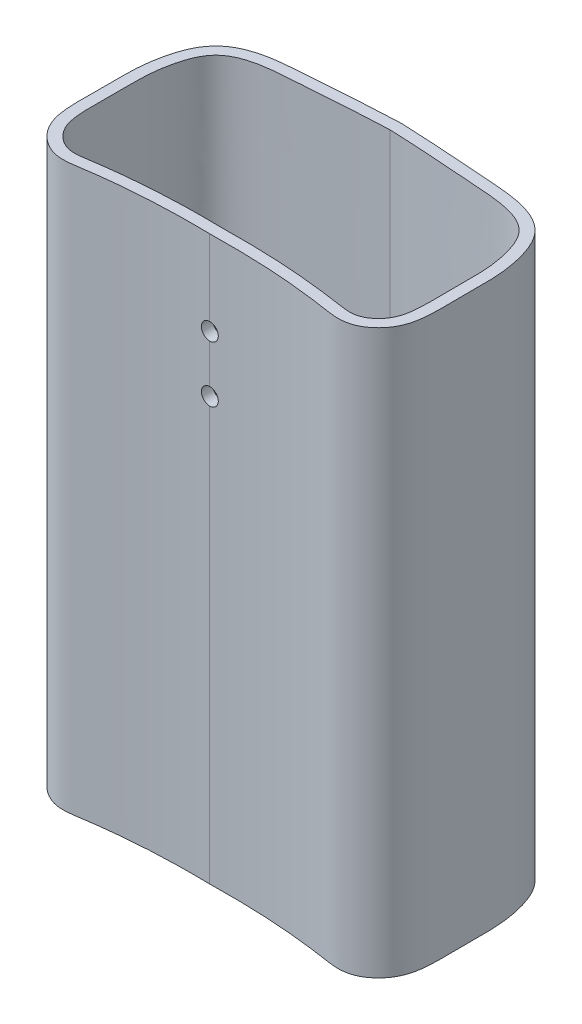
from build123d import *

# Parameters (mm, degrees)
Y_KSEKLIK_EKSTR_ZYON1_DEPTH = 100
IZIM3_R                     = 1.5
KES_EKSTR_ZYON1_DEPTH       = 10


with BuildPart() as part:
    # Çizim1 → Yükseklik-Ekstrüzyon1 (new body)
    with BuildSketch(Plane(origin=(0, 0, 0), x_dir=(1, 0, 0), z_dir=(0, 1, 0))):
        with BuildLine():
            add(Edge.make_bspline(
                [(0, 19.93026058), (-0.456912568, 19.913044156), (-1.378839943, 19.876102375), (-3.156788416, 19.794351658), (-5.316920069, 19.678016457), (-7.841775812, 19.519464651), (-11.189989105, 19.289535487), (-14.591856328, 19.030001897), (-18.287199098, 18.784185441), (-21.261903526, 18.486143303), (-24.224686789, 17.856341815), (-26.580303347, 16.823221448), (-28.255147115, 15.518782085), (-29.688879781, 13.830583224), (-30.777655499, 11.429600247), (-31.51434839, 8.588281022), (-31.923221921, 5.825022746), (-32.0440681, 3.056583967), (-31.987890956, 0.428578042), (-32.01708483, -2.068301489), (-32.051981724, -4.710614271), (-32.003565709, -7.406147252), (-31.648596651, -10.011539852), (-30.627497359, -12.156132439), (-29.506723331, -13.557042968), (-28.106496306, -14.69864579), (-26.704959708, -15.36667834), (-25.45815578, -15.635885952), (-24.289493621, -15.718491881), (-22.955316386, -15.603236807), (-21.618498846, -15.384071712), (-20.348009107, -15.200505648), (-19.074667671, -15.027357671), (-17.394234251, -14.818668954), (-15.310241024, -14.594364683), (-12.822903196, -14.381928941), (-9.502603912, -14.169892052), (-6.138514535, -14.059211791), (-2.68485003, -14.038099162), (-0.889123923, -14.056381118), (0, -14.071445744)],
                knots=[-0.000855941, -0.000855941, -0.000855941, -0.000855941, 0.014788494, 0.030432928, 0.061721797, 0.093010666, 0.124299534, 0.186877272, 0.218166141, 0.249455009, 0.280743878, 0.312032747, 0.327677181, 0.343321616, 0.374610484, 0.405899353, 0.437188222, 0.46847709, 0.499765959, 0.531054828, 0.562343697, 0.593632565, 0.624921434, 0.640565869, 0.656210303, 0.671854737, 0.687499172, 0.695321389, 0.703143606, 0.71878804, 0.734432475, 0.750076909, 0.765721343, 0.781365778, 0.812654647, 0.843943515, 0.875232384, 0.937810121, 0.96909899, 1.000387859, 1.000387859, 1.000387859, 1.000387859], degree=3))
            add(Edge.make_bspline(
                [(0, -14.071445744), (0.889123923, -14.056381118), (2.68485003, -14.038099162), (6.138514535, -14.059211791), (9.502603912, -14.169892052), (12.822903196, -14.381928941), (15.310241024, -14.594364683), (17.394234251, -14.818668954), (19.074667671, -15.027357671), (20.348009107, -15.200505648), (21.618498846, -15.384071712), (22.955316386, -15.603236807), (24.289493621, -15.718491881), (25.45815578, -15.635885952), (26.704959708, -15.36667834), (28.106496306, -14.69864579), (29.506723331, -13.557042968), (30.627497359, -12.156132439), (31.648596651, -10.011539852), (32.003565709, -7.406147252), (32.051981724, -4.710614271), (32.01708483, -2.068301489), (31.987890956, 0.428578042), (32.0440681, 3.056583967), (31.923221921, 5.825022746), (31.51434839, 8.588281022), (30.777655499, 11.429600247), (29.688879781, 13.830583224), (28.255147115, 15.518782085), (26.580303347, 16.823221448), (24.224686789, 17.856341815), (21.261903526, 18.486143303), (18.287199098, 18.784185441), (14.591856328, 19.030001897), (11.189989105, 19.289535487), (7.841775812, 19.519464651), (5.316920069, 19.678016457), (3.156788416, 19.794351658), (1.378839943, 19.876102375), (0.456912568, 19.913044156), (0, 19.93026058)],
                knots=[-0.000855941, -0.000855941, -0.000855941, -0.000855941, 0.030432928, 0.061721797, 0.124299534, 0.155588403, 0.186877272, 0.218166141, 0.233810575, 0.249455009, 0.265099444, 0.280743878, 0.296388312, 0.30421053, 0.312032747, 0.327677181, 0.343321616, 0.35896605, 0.374610484, 0.405899353, 0.437188222, 0.46847709, 0.499765959, 0.531054828, 0.562343697, 0.593632565, 0.624921434, 0.656210303, 0.671854737, 0.687499172, 0.71878804, 0.750076909, 0.781365778, 0.812654647, 0.875232384, 0.906521253, 0.937810121, 0.96909899, 0.984743425, 1.000387859, 1.000387859, 1.000387859, 1.000387859], degree=3))
        make_face()
        with BuildLine():
            add(Edge.make_bspline(
                [(0, 17.928841308), (-5.820212095, 17.709536244), (-13.903357487, 17.042587637), (-26.87571665, 16.196014495), (-29.550286899, 8.929250371), (-30.090469717, 4.336098712), (-29.940693307, -0.887353996), (-30.154927851, -5.701691423), (-29.637182829, -10.928766593), (-26.031174583, -14.081750554), (-15.720131404, -12.349312728), (-7.807226576, -11.938879102), (0, -12.071158692)],
                knots=[0, 0, 0, 0, 0.198459501, 0.336012796, 0.394476639, 0.459729731, 0.505376957, 0.582750838, 0.635932872, 0.690008906, 0.731880659, 1, 1, 1, 1], degree=3))
            add(Edge.make_bspline(
                [(0, 17.928841308), (5.820212095, 17.709536244), (13.903357487, 17.042587637), (26.87571665, 16.196014495), (29.550286899, 8.929250371), (30.090469717, 4.336098712), (29.940693307, -0.887353996), (30.154927851, -5.701691423), (29.637182829, -10.928766593), (26.031174583, -14.081750554), (15.720131404, -12.349312728), (7.807226576, -11.938879102), (0, -12.071158692)],
                knots=[0, 0, 0, 0, 0.198459501, 0.336012796, 0.394476639, 0.459729731, 0.505376957, 0.582750838, 0.635932872, 0.690008906, 0.731880659, 1, 1, 1, 1], degree=3))
        make_face(mode=Mode.SUBTRACT)
    extrude(amount=Y_KSEKLIK_EKSTR_ZYON1_DEPTH)

    # Çizim3 → Kes-Ekstrüzyon1 (cut)
    with BuildSketch(Plane(origin=(0, 0, 14.071445744), x_dir=(-1, 0, 0), z_dir=(0, 0, -1))):
        with Locations((0, 85)):
            Circle(IZIM3_R)
        with Locations((0, 75)):
            Circle(IZIM3_R)
    extrude(amount=KES_EKSTR_ZYON1_DEPTH, mode=Mode.SUBTRACT)


solid = part.part
